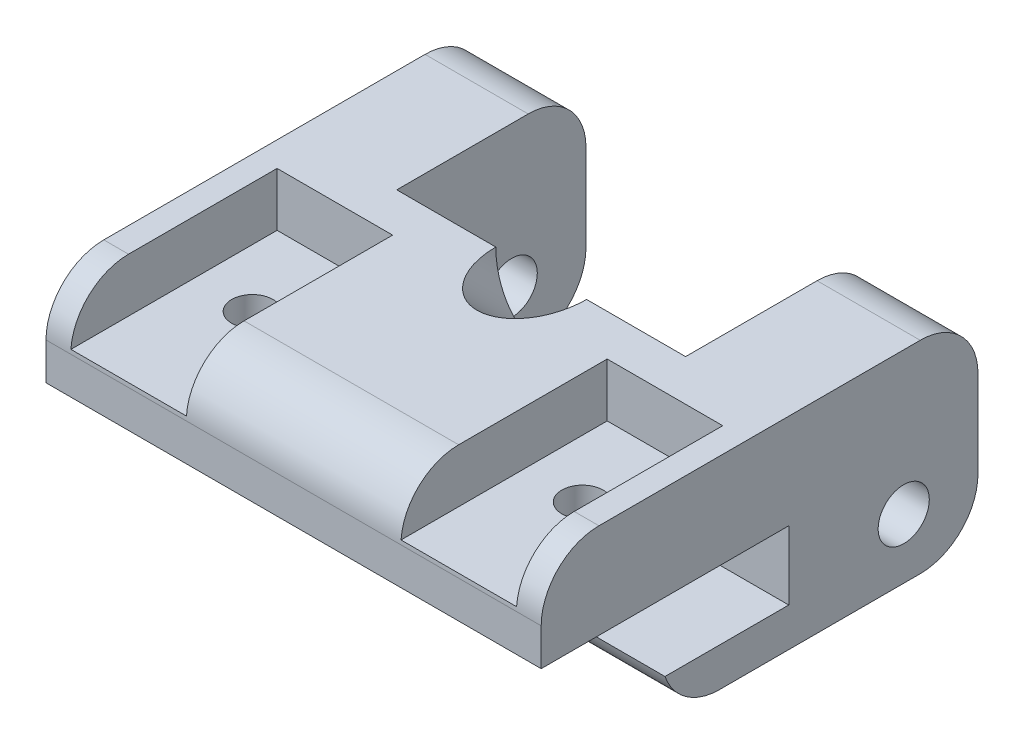
from build123d import *

# Parameters (mm, degrees)
SALIENTE_EXTRUIR1_DEPTH      = 5
SALIENTE_EXTRUIR1_DEPTH_BACK = 13
CROQUIS1_R                   = 2.5
SALIENTE_EXTRUIR2_DEPTH      = 6.5
SALIENTE_EXTRUIR2_DEPTH_BACK = 10
CORTAR_EXTRUIR2_REACH        = 83.059
CROQUIS4_R                   = 3.1
CROQUIS4_W                   = 30
CROQUIS4_H                   = 13
CORTAR_EXTRUIR3_DEPTH        = 10
CORTAR_EXTRUIR3_DEPTH_BACK   = 10
CROQUIS5_R                   = 5.5
SALIENTE_EXTRUIR3_REACH      = 83.059
CROQUIS6_W                   = 15
CROQUIS6_H                   = 4.684186211
REDONDEO1_R                  = 7


with BuildPart() as part:
    # Croquis1 → Saliente-Extruir1 (new, two sides: drawn at the far end of the back side and taken through both)
    with BuildSketch(Plane(origin=(0, 0, 0), x_dir=(1, 0, 0), z_dir=(0, 1, 0)).offset(-SALIENTE_EXTRUIR1_DEPTH_BACK)):
        Polygon((0, 0), (60, 0), (60, 30), (60, 52.93), (47.5, 52.93), (47.5, 30), (12.5, 30), (12.5, 52.93), (0, 52.93), (0, 30), align=None)
        with Locations(Location((10, 15, 0), (0, 0, 270))):
            Circle(CROQUIS1_R, mode=Mode.SUBTRACT)
        with Locations(Location((50, 15, 0), (0, 0, 270))):
            Circle(CROQUIS1_R, mode=Mode.SUBTRACT)
    extrude(amount=SALIENTE_EXTRUIR1_DEPTH + SALIENTE_EXTRUIR1_DEPTH_BACK)

    # Croquis2 → Saliente-Extruir2 (add, two sides: drawn at the far end of the back side and taken through both)
    with BuildSketch(Plane(origin=(0, 5, 0), x_dir=(1, 0, 0), z_dir=(0, 1, 0)).offset(-SALIENTE_EXTRUIR2_DEPTH_BACK)):
        Polygon((3, 0), (3, 25), (17, 25), (17, 0), (43, 0), (43, 25), (57, 25), (57, 0), (60, 0), (60, 52.93), (47.5, 52.93), (47.5, 30), (12.5, 30), (12.5, 52.93), (0, 52.93), (0, 0), align=None)
    extrude(amount=SALIENTE_EXTRUIR2_DEPTH + SALIENTE_EXTRUIR2_DEPTH_BACK)

    # Cortar-Extruir2: up to this face of the body (flat: up to its plane)
    cortar_extruir2_end = Plane(part.part.faces().sort_by_distance((60, -0.75, -26.465))[0])
    # Croquis4 → Cortar-Extruir2 (cut, up to the picked face)
    with BuildSketch(Plane.ZY, mode=Mode.PRIVATE) as cortar_extruir2_sk1:
        with Locations((-43.93, -5.75)):
            Circle(CROQUIS4_R)
    cortar_extruir2_tool1 = split(extrude(cortar_extruir2_sk1.sketch, amount=-CORTAR_EXTRUIR2_REACH, mode=Mode.PRIVATE), bisect_by=cortar_extruir2_end, keep=Keep.BOTH, mode=Mode.PRIVATE)
    # Croquis4 → Cortar-Extruir2 (cut, up to the picked face)
    with BuildSketch(Plane.ZY, mode=Mode.PRIVATE) as cortar_extruir2_sk2:
        with Locations((-15, -6.5)):
            Rectangle(CROQUIS4_W, CROQUIS4_H)
    cortar_extruir2_tool2 = split(extrude(cortar_extruir2_sk2.sketch, amount=-CORTAR_EXTRUIR2_REACH, mode=Mode.PRIVATE), bisect_by=cortar_extruir2_end, keep=Keep.BOTH, mode=Mode.PRIVATE)
    add(cortar_extruir2_tool1.solids().sort_by(Axis((0, -5.75, -43.93), (1, 0, 0)))[0], mode=Mode.SUBTRACT)
    add(cortar_extruir2_tool2.solids().sort_by(Axis((0, -6.5, -15), (1, 0, 0)))[0], mode=Mode.SUBTRACT)

    # Croquis5 → Cortar-Extruir3 (cut, two sides: drawn at the far end of the back side and taken through both)
    with BuildSketch(Plane(origin=(0, -9.25, -9.25), x_dir=(-1, 0, 0), z_dir=(0, -0.7071067811865488, -0.7071067811865464)).offset(-CORTAR_EXTRUIR3_DEPTH_BACK)):
        with Locations((-30, 29.344931419)):
            Circle(CROQUIS5_R)
    extrude(amount=CORTAR_EXTRUIR3_DEPTH + CORTAR_EXTRUIR3_DEPTH_BACK, mode=Mode.SUBTRACT)

    # Saliente-Extruir3: up to this face of the body (flat: up to its plane)
    saliente_extruir3_end = Plane(part.part.faces().sort_by_distance((60, 1.98040053, -30.964309834))[0])
    # Croquis6 → Saliente-Extruir3 (add, up to the picked face)
    with BuildSketch(Plane.ZY, mode=Mode.PRIVATE) as saliente_extruir3_sk1:
        with Locations((-22.5, -10.657906894)):
            Rectangle(CROQUIS6_W, CROQUIS6_H)
    saliente_extruir3_tool1 = split(extrude(saliente_extruir3_sk1.sketch, amount=-SALIENTE_EXTRUIR3_REACH, mode=Mode.PRIVATE), bisect_by=saliente_extruir3_end, keep=Keep.BOTH, mode=Mode.PRIVATE)
    add(saliente_extruir3_tool1.solids().sort_by(Axis((0, -10.657907, -22.5), (1, 0, 0)))[0])

    # Redondeo1
    # the kernel refuses this fillet: 7 mm, written as the material it takes off along each edge
    with BuildSketch(Plane(origin=(-16.514578123, -13, -15), x_dir=(0, 0, -1), z_dir=(1, 0, 0))) as redondeo1_piece_1:
        with BuildLine():
            CenterArc((6.605831249, 7), REDONDEO1_R, 199.319193713, 70.680806287)
            Line((0, 4.684186211), (0, 0))
            Line((0, 0), (6.605831249, 0))
        make_face()
    extrude(amount=93.029156246, mode=Mode.SUBTRACT)
    with BuildSketch(Plane(origin=(77.5, -13, -52.93), x_dir=(0, 1, 0), z_dir=(-1, 0, 0)), Plane(origin=(30, 11.5, -52.93), x_dir=(0, 0, 1), z_dir=(-1, 0, 0)), Plane(origin=(77.5, 11.5, -52.93), x_dir=(0, 0, 1), z_dir=(-1, 0, 0))) as redondeo1_piece_2:
        with BuildLine():
            CenterArc((REDONDEO1_R, -REDONDEO1_R), REDONDEO1_R, 90, 90)
            Line((0, -REDONDEO1_R), (0, 0))
            Line((0, 0), (REDONDEO1_R, 0))
        make_face()
    extrude(amount=47.5, mode=Mode.SUBTRACT)
    with BuildSketch(Plane(origin=(30, -13, -52.93), x_dir=(0, 0, 1), z_dir=(-1, 0, 0))) as redondeo1_piece_3:
        with BuildLine():
            CenterArc((REDONDEO1_R, REDONDEO1_R), REDONDEO1_R, 180, 90)
            Line((0, REDONDEO1_R), (0, 0))
            Line((0, 0), (REDONDEO1_R, 0))
        make_face()
    extrude(amount=47.5, mode=Mode.SUBTRACT)
    with BuildSketch(Plane(origin=(-17.5, 11.5, 0), x_dir=(0, -1, 0), z_dir=(1, 0, 0)), Plane(origin=(39.5, 11.5, 0), x_dir=(0, -1, 0), z_dir=(1, 0, 0))) as redondeo1_piece_4:
        with BuildLine():
            CenterArc((REDONDEO1_R, REDONDEO1_R), REDONDEO1_R, 180, 90)
            Line((0, REDONDEO1_R), (0, 0))
            Line((0, 0), (REDONDEO1_R, 0))
        make_face()
    extrude(amount=38, mode=Mode.SUBTRACT)
    with BuildSketch(Plane(origin=(-0.5, 11.5, 0), x_dir=(0, -1, 0), z_dir=(1, 0, 0))) as redondeo1_piece_5:
        with BuildLine():
            CenterArc((REDONDEO1_R, REDONDEO1_R), REDONDEO1_R, 180, 90)
            Line((0, REDONDEO1_R), (0, 0))
            Line((0, 0), (REDONDEO1_R, 0))
        make_face()
    extrude(amount=61, mode=Mode.SUBTRACT)


solid = part.part
